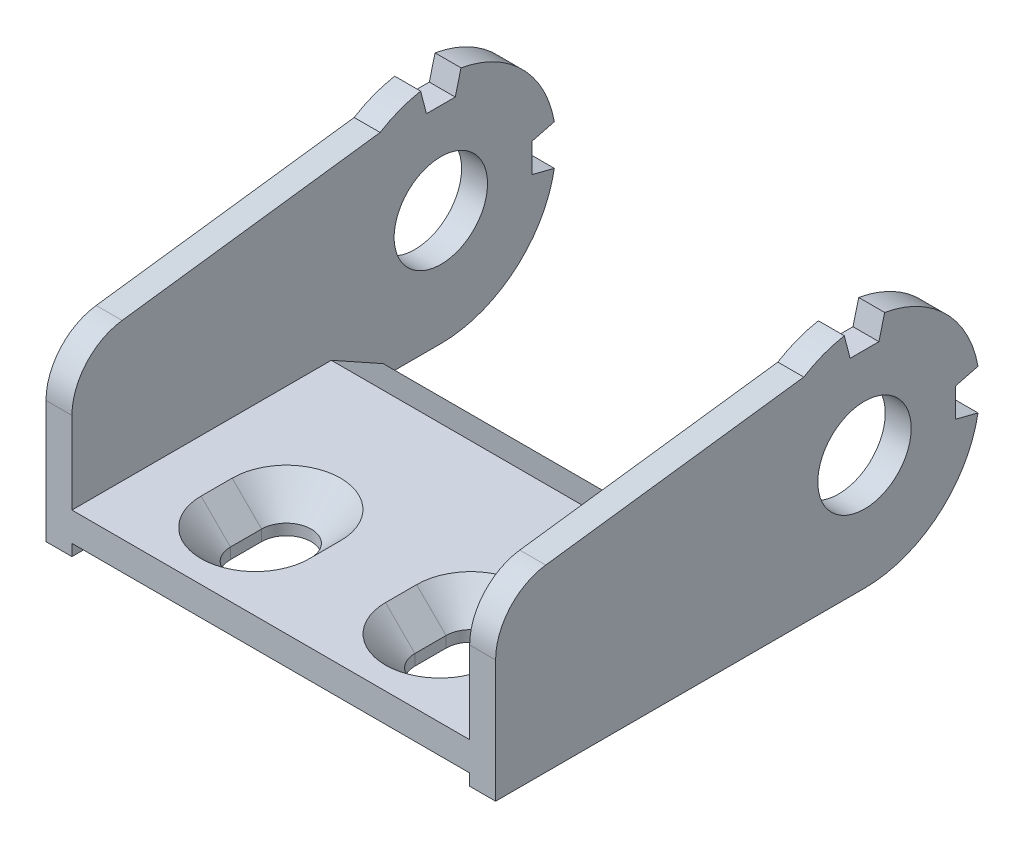
from build123d import *

# Parameters (mm, degrees)
BODY_DEPTH                                      = 32
BODY_DEPTH_BACK                                 = 15
PIVOT_HOLE_DEPTH                                = 40.272286666
PIVOT_HOLE_DEPTH_BACK                           = 40.272286666
PIVOT_HOLE_SKETCH_R                             = 4.05
OUTSIDE_SHAPE_CUT_OUT_DEPTH                     = 40.272286666
OUTSIDE_SHAPE_CUT_OUT_DEPTH_BACK                = 40.272286666
OUTSIDE_SHAPE_CUT_OUT_SKETCH_W                  = 49
OUTSIDE_SHAPE_CUT_OUT_SKETCH_H                  = 22
INSIDE_START                                    = 17.25
INSIDE_SHAPE_CUT_OUT_DEPTH                      = 34.5
F_2_START                                       = -11.75
F_2_LATERAL_SLOTS_ORIENTED_LONGITUDINALLY_DEPTH = 3.5


with BuildPart() as part:
    # Profile Sketch → Body (new, two sides: drawn at the far end of the back side and taken through both)
    with BuildSketch(Plane.XY.offset(-BODY_DEPTH_BACK)):
        Polygon((-19.5, -11.75), (19.5, -11.75), (19.5, 8.25), (17.25, 8.25), (17.25, -8.25), (-17.25, -8.25), (-17.25, 8.25), (-19.5, 8.25), align=None)
    extrude(amount=BODY_DEPTH + BODY_DEPTH_BACK)

    # Pivot Hole Sketch → Pivot Hole (cut, two sides: drawn at the far end of the back side and taken through both)
    with BuildSketch(Plane(origin=(0, 0, 0), x_dir=(0, 0, -1), z_dir=(1, 0, 0)).offset(-PIVOT_HOLE_DEPTH_BACK)):
        with Locations((0, -1.75)):
            Circle(PIVOT_HOLE_SKETCH_R)
    extrude(amount=PIVOT_HOLE_DEPTH + PIVOT_HOLE_DEPTH_BACK, mode=Mode.SUBTRACT)

    # Outside Shape Cut Out Sketch → Outside Shape Cut Out (cut, two sides: drawn at the far end of the back side and taken through both)
    with BuildSketch(Plane(origin=(0, 0, 0), x_dir=(0, 0, -1), z_dir=(1, 0, 0)).offset(-OUTSIDE_SHAPE_CUT_OUT_DEPTH_BACK)):
        with Locations((-9.5, -2.75)):
            Rectangle(OUTSIDE_SHAPE_CUT_OUT_SKETCH_W, OUTSIDE_SHAPE_CUT_OUT_SKETCH_H)
        with BuildLine():
            Line((-27.649101987, 3.819656009), (-5.267826876, 6.75))
            ThreePointArc((-5.267826876, 6.75), (-3.57284062, 7.589957703), (-1.75, 8.095684334))
            Line((-1.75, 8.095684334), (-1.25, 6.15))
            Line((-1.25, 6.15), (1.25, 6.15))
            Line((1.25, 6.15), (1.75, 8.095684334))
            ThreePointArc((1.75, 8.095684334), (7.071067812, 5.321067812), (9.845684334, 0))
            Line((9.845684334, 0), (7.9, -0.5))
            Line((7.9, -0.5), (7.9, -3))
            Line((7.9, -3), (9.845684334, -3.5))
            ThreePointArc((9.845684334, -3.5), (6.422616289, -9.414854858), (0, -11.75))
            Line((0, -11.75), (-32, -11.75))
            Line((-32, -11.75), (-32, -1.138031619))
            ThreePointArc((-32, -1.138031619), (-30.758025408, 2.160035244), (-27.649101987, 3.819656009))
        make_face(mode=Mode.SUBTRACT)
    extrude(amount=OUTSIDE_SHAPE_CUT_OUT_DEPTH + OUTSIDE_SHAPE_CUT_OUT_DEPTH_BACK, mode=Mode.SUBTRACT)

    # Inside Shape Cut Out Sketch → Inside Shape Cut Out (cut)
    with BuildSketch(Plane(origin=(0, 0, 0), x_dir=(0, 0, -1), z_dir=(1, 0, 0)).offset(INSIDE_START)):
        Polygon((-29, -9.75), (-29, -11.75), (-32, -11.75), (-32, -10.75), (-30.5, -10.75), (-30.5, -9.75), align=None)
        Polygon((-9.5, -8.25), (-5, -10.75), (-5, -11.75), (7.599342077, -11.75), (7.599342077, -8.25), align=None)
    extrude(amount=-INSIDE_SHAPE_CUT_OUT_DEPTH, mode=Mode.SUBTRACT)

    # 2 Lateral Slots Oriented Longitudinally: read off the stored shape, not the designer's step
    # 2 Lateral Slots Oriented Longitudina 2 → 2 Lateral Slots Oriented Longitudinally (cut)
    with BuildSketch(Plane(origin=(0, 0, 0), x_dir=(1, 0, 0), z_dir=(0, 1, 0)).offset(F_2_START)):
        with BuildLine():
            Line((10.15, -25.35), (10.15, -22.65))
            ThreePointArc((10.15, -22.65), (8, -20.5), (5.85, -22.65))
            Line((5.85, -22.65), (5.85, -25.35))
            ThreePointArc((5.85, -25.35), (8, -27.5), (10.15, -25.35))
        make_face()
        with BuildLine():
            Line((-5.85, -25.35), (-5.85, -22.65))
            ThreePointArc((-5.85, -22.65), (-8, -20.5), (-10.15, -22.65))
            Line((-10.15, -22.65), (-10.15, -25.35))
            ThreePointArc((-10.15, -25.35), (-8, -27.5), (-5.85, -25.35))
        make_face()
    extrude(amount=F_2_LATERAL_SLOTS_ORIENTED_LONGITUDINALLY_DEPTH, mode=Mode.SUBTRACT)

    # 2 Lateral Slots Oriented Longitudina 3: loft between two sections, ruled curve by curve
    f_2_lateral_slots_oriented_longitudina_3_from = [
        Edge.make_three_point_arc((10.15, -10.8, 22.65), (9.52027958, -10.8, 21.12972042), (8, -10.8, 20.5)),
        Edge.make_three_point_arc((8, -10.8, 20.5), (6.47972042, -10.8, 21.12972042), (5.85, -10.8, 22.65)),
        Edge.make_three_point_arc((5.85, -10.8, 25.35), (6.47972042, -10.8, 26.87027958), (8, -10.8, 27.5)),
        Edge.make_three_point_arc((8, -10.8, 27.5), (9.52027958, -10.8, 26.87027958), (10.15, -10.8, 25.35)),
        Edge.make_line((5.85, -10.8, 22.65), (5.85, -10.8, 25.35)),
        Edge.make_line((10.15, -10.8, 22.65), (10.15, -10.8, 25.35)),
    ]
    f_2_lateral_slots_oriented_longitudina_3_to = [
        Edge.make_three_point_arc((12.7, -8.25, 22.65), (11.323401872, -8.25, 19.326598128), (8, -8.25, 17.95)),
        Edge.make_three_point_arc((8, -8.25, 17.95), (4.676598128, -8.25, 19.326598128), (3.3, -8.25, 22.65)),
        Edge.make_three_point_arc((3.3, -8.25, 25.35), (4.676598128, -8.25, 28.673401872), (8, -8.25, 30.05)),
        Edge.make_three_point_arc((8, -8.25, 30.05), (11.323401872, -8.25, 28.673401872), (12.7, -8.25, 25.35)),
        Edge.make_line((3.3, -8.25, 22.65), (3.3, -8.25, 25.35)),
        Edge.make_line((12.7, -8.25, 22.65), (12.7, -8.25, 25.35)),
    ]
    f_2_lateral_slots_oriented_longitudina_3 = Solid(Shell([*[Face.make_surface_from_curves(f_2_lateral_slots_oriented_longitudina_3_from[k], f_2_lateral_slots_oriented_longitudina_3_to[k]) for k in range(6)], Face(Wire(f_2_lateral_slots_oriented_longitudina_3_from)), Face(Wire(f_2_lateral_slots_oriented_longitudina_3_to))]))
    add(f_2_lateral_slots_oriented_longitudina_3, mode=Mode.SUBTRACT)

    # 2 Lateral Slots Oriented Longitudina 4: loft between two sections, ruled curve by curve
    f_2_lateral_slots_oriented_longitudina_4_from = [
        Edge.make_three_point_arc((-5.85, -10.8, 22.65), (-6.47972042, -10.8, 21.12972042), (-8, -10.8, 20.5)),
        Edge.make_three_point_arc((-8, -10.8, 20.5), (-9.52027958, -10.8, 21.12972042), (-10.15, -10.8, 22.65)),
        Edge.make_three_point_arc((-10.15, -10.8, 25.35), (-9.52027958, -10.8, 26.87027958), (-8, -10.8, 27.5)),
        Edge.make_three_point_arc((-8, -10.8, 27.5), (-6.47972042, -10.8, 26.87027958), (-5.85, -10.8, 25.35)),
        Edge.make_line((-10.15, -10.8, 22.65), (-10.15, -10.8, 25.35)),
        Edge.make_line((-5.85, -10.8, 22.65), (-5.85, -10.8, 25.35)),
    ]
    f_2_lateral_slots_oriented_longitudina_4_to = [
        Edge.make_three_point_arc((-3.3, -8.25, 22.65), (-4.676598128, -8.25, 19.326598128), (-8, -8.25, 17.95)),
        Edge.make_three_point_arc((-8, -8.25, 17.95), (-11.323401872, -8.25, 19.326598128), (-12.7, -8.25, 22.65)),
        Edge.make_three_point_arc((-12.7, -8.25, 25.35), (-11.323401872, -8.25, 28.673401872), (-8, -8.25, 30.05)),
        Edge.make_three_point_arc((-8, -8.25, 30.05), (-4.676598128, -8.25, 28.673401872), (-3.3, -8.25, 25.35)),
        Edge.make_line((-12.7, -8.25, 22.65), (-12.7, -8.25, 25.35)),
        Edge.make_line((-3.3, -8.25, 22.65), (-3.3, -8.25, 25.35)),
    ]
    f_2_lateral_slots_oriented_longitudina_4 = Solid(Shell([*[Face.make_surface_from_curves(f_2_lateral_slots_oriented_longitudina_4_from[k], f_2_lateral_slots_oriented_longitudina_4_to[k]) for k in range(6)], Face(Wire(f_2_lateral_slots_oriented_longitudina_4_from)), Face(Wire(f_2_lateral_slots_oriented_longitudina_4_to))]))
    add(f_2_lateral_slots_oriented_longitudina_4, mode=Mode.SUBTRACT)


solid = part.part
